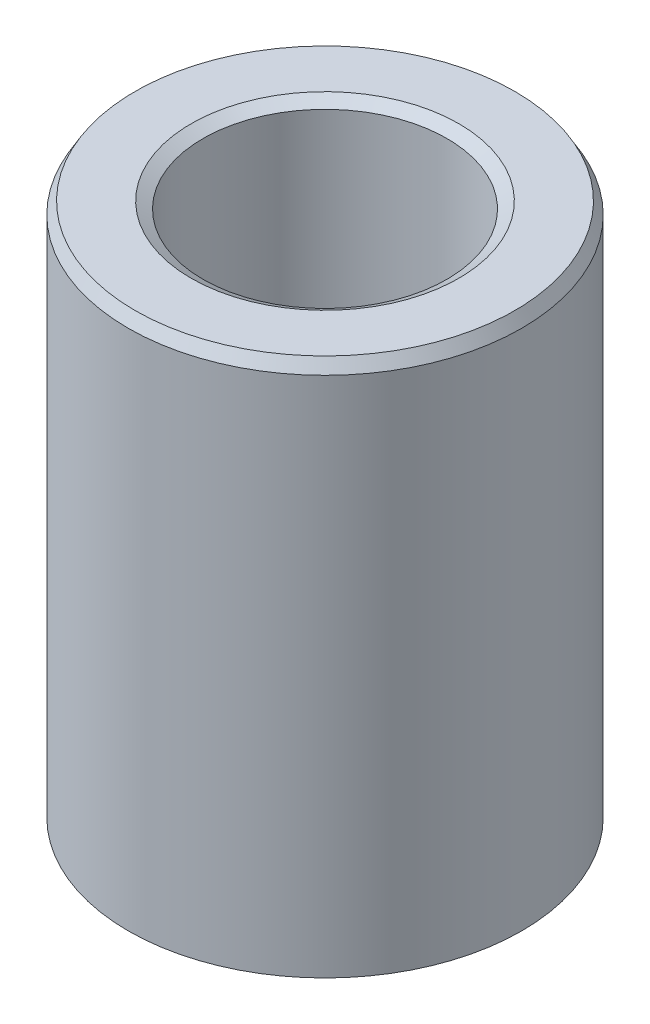
from build123d import *
from OCP.BRepFilletAPI import BRepFilletAPI_MakeChamfer

# Parameters (mm, degrees)
SKETCH1_R           = 40
BOSS_EXTRUDE1_DEPTH = 109.94287064
SKETCH2_R           = 24.805616264
CUT_EXTRUDE1_DEPTH  = 124.642366544
CHAMFER1_SIZE       = 2.421336353
CHAMFER1_SIZE2      = 1.397959195


with BuildPart() as part:
    # Sketch1 → Boss-Extrude1 (new body)
    with BuildSketch(Plane(origin=(0, 0, 0), x_dir=(1, 0, 0), z_dir=(0, 1, 0))):
        Circle(SKETCH1_R)
    extrude(amount=BOSS_EXTRUDE1_DEPTH)

    # Sketch2 → Cut-Extrude1 (cut, through all)
    with BuildSketch(Plane(origin=(0, 0, 0), x_dir=(1, 0, 0), z_dir=(0, 1, 0))):
        Circle(SKETCH2_R)
    extrude(amount=CUT_EXTRUDE1_DEPTH, mode=Mode.SUBTRACT)

    # Chamfer1: one chamfer whose edges measure the first distance from different faces: ONE call of the kernel's chamfer builder (chamfer() names one face for all edges)
    chamfer1_edges_1 = [part.edges().sort_by_distance(p)[0] for p in [
        (-24.805616264, 109.94287064, 0),
    ]]
    chamfer1_side_1 = [part.faces().sort_by_distance(p)[0] for p in [
        (-38.86862915, 109.94287064, 0),
    ]]
    chamfer1_edges_2 = [part.edges().sort_by_distance(p)[0] for p in [
        (-24.805616264, 0, 0),
    ]]
    chamfer1_side_2 = [part.faces().sort_by_distance(p)[0] for p in [
        (-24.805616264, 54.97143532, 0),
    ]]
    chamfer1_edges_3 = [part.edges().sort_by_distance(p)[0] for p in [
        (-40, 0, 0),
    ]]
    chamfer1_side_3 = [part.faces().sort_by_distance(p)[0] for p in [
        (-38.86862915, 0, 0),
    ]]
    chamfer1_edges_4 = [part.edges().sort_by_distance(p)[0] for p in [
        (-40, 109.94287064, 0),
    ]]
    chamfer1_side_4 = [part.faces().sort_by_distance(p)[0] for p in [
        (-40, 54.97143532, 0),
    ]]
    chamfer1 = BRepFilletAPI_MakeChamfer(part.part.solid().wrapped)
    for e in chamfer1_edges_1:
        chamfer1.Add(CHAMFER1_SIZE, CHAMFER1_SIZE2, e.wrapped, chamfer1_side_1[0].wrapped)  # the first distance lies on this face
    for e in chamfer1_edges_2:
        chamfer1.Add(CHAMFER1_SIZE, CHAMFER1_SIZE2, e.wrapped, chamfer1_side_2[0].wrapped)  # the first distance lies on this face
    for e in chamfer1_edges_3:
        chamfer1.Add(CHAMFER1_SIZE, CHAMFER1_SIZE2, e.wrapped, chamfer1_side_3[0].wrapped)  # the first distance lies on this face
    for e in chamfer1_edges_4:
        chamfer1.Add(CHAMFER1_SIZE, CHAMFER1_SIZE2, e.wrapped, chamfer1_side_4[0].wrapped)  # the first distance lies on this face
    add(Compound.cast(chamfer1.Shape()), mode=Mode.REPLACE)


solid = part.part
